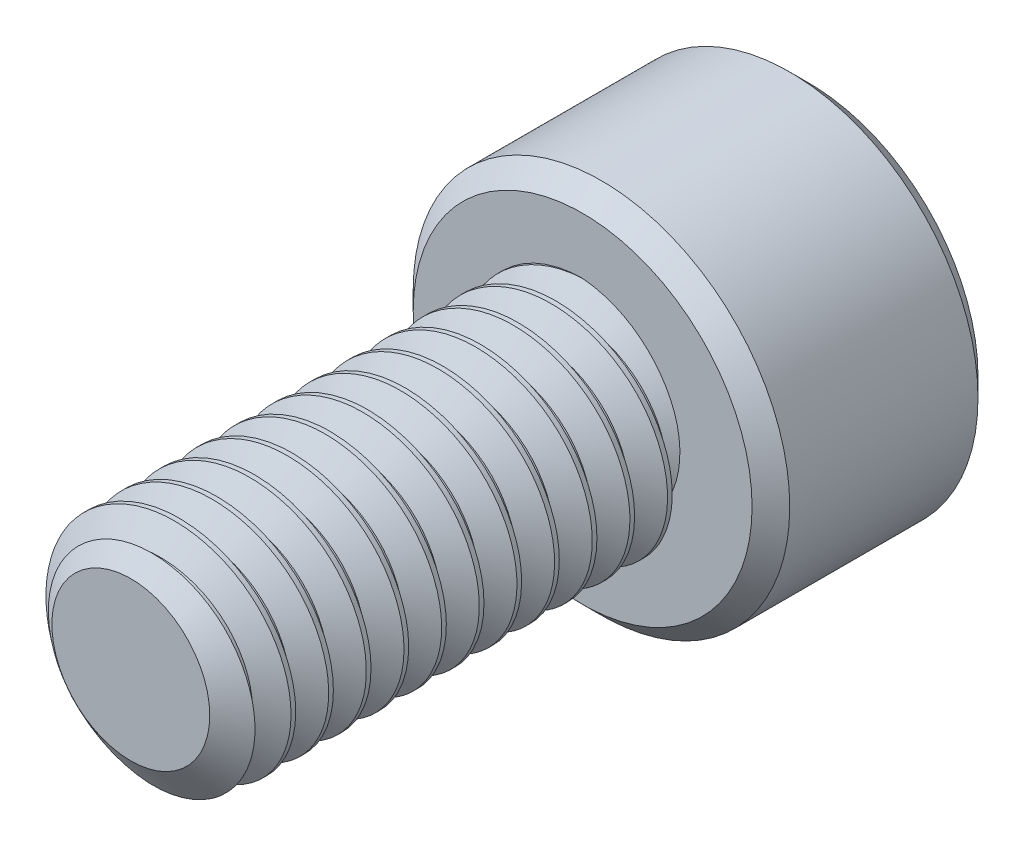
from build123d import *

# Parameters (mm, degrees)
SKETCH1_R          = 3
EXTRUDE1_DEPTH     = 12
CUT_SWEEP1_PITCH   = 1
SKETCH6_R          = 5
EXTRUDE2_DEPTH     = 6
CUT_EXTRUDE1_DEPTH = 3.75
CHAMFER1_SIZE      = 0.5


with BuildPart() as part:
    # Sketch1 → Extrude1 (new body)
    with BuildSketch(Plane.XY):
        Circle(SKETCH1_R)
    extrude(amount=-EXTRUDE1_DEPTH)

    # Cut-Sweep1: the profile of Sketch3 profile screwed along a right-hand helix of 13 turns, 6 arcs to a turn; built about Z, then put on its axis
    cut_sweep1_z = Axis((0, 0, 0), (0, 0, 1))
    cut_sweep1_corners = [(3.0003, 0, -0.875173205), (2.350480947, 0, -0.5), (2.350480947, 0, -0.375), (3.0003, 0, 0.000173205)]
    with BuildLine(mode=Mode.PRIVATE) as cut_sweep1_profile:
        Line(cut_sweep1_corners[0], cut_sweep1_corners[1])
        Line(cut_sweep1_corners[1], cut_sweep1_corners[2])
        Line(cut_sweep1_corners[2], cut_sweep1_corners[3])
        Line(cut_sweep1_corners[3], cut_sweep1_corners[0])
    cut_sweep1_cap = Face(cut_sweep1_profile.wire())
    cut_sweep1_turn_angles = [0, 30, 60, 90, 120, 150, 180, 210, 240, 270, 300, 330, 360]
    cut_sweep1_turn_weights = [1, 0.8660254037844387, 1, 0.8660254037844387, 1, 0.8660254037844387, 1, 0.8660254037844387, 1, 0.8660254037844387, 1, 0.8660254037844387, 1]
    cut_sweep1_turn_rails = [Edge.make_bspline([Vector(p[0], p[1], 0).rotate(cut_sweep1_z, cut_sweep1_turn_angles[k]) / cut_sweep1_turn_weights[k] + Vector(0, 0, p[2] + CUT_SWEEP1_PITCH * cut_sweep1_turn_angles[k] / 360) for k in range(13)], [0, 0, 0, 1, 1, 2, 2, 3, 3, 4, 4, 5, 5, 6, 6, 6], 2, cut_sweep1_turn_weights) for p in cut_sweep1_corners]
    cut_sweep1_turn_sides = [Face.make_surface_from_curves(cut_sweep1_turn_rails[p[0]], cut_sweep1_turn_rails[p[1]]) for p in [(0, 1), (1, 2), (2, 3), (3, 0)]]
    cut_sweep1 = Plane(origin=(0, 0, 0), x_dir=(0, 1, 0), z_dir=(0, 0, -1)) * Solid(Shell([*[p.moved(Location((0, 0, CUT_SWEEP1_PITCH * i))) for i in range(13) for p in cut_sweep1_turn_sides], cut_sweep1_cap, cut_sweep1_cap.rotate(cut_sweep1_z, 4680).moved(Location((0, 0, CUT_SWEEP1_PITCH * 4680 / 360)))]))
    add(cut_sweep1, mode=Mode.SUBTRACT)

    # Sketch4 → Cut-Revolve1 (revolve, cut)
    with BuildSketch(Plane(origin=(0, 0, 0), x_dir=(0, 0, -1), z_dir=(1, 0, 0)), mode=Mode.PRIVATE) as cut_revolve1_sk:
        Polygon((0.632650852, 3), (0, 2.096480947), (0, 3), align=None)
    revolve(cut_revolve1_sk.sketch.rotate(Axis((0, 0, 0), (0, 0, -1)), 244.349292568), axis=Axis((0, 0, 0), (0, 0, -1)), mode=Mode.SUBTRACT)

    # Sketch6 → Extrude2 (add)
    with BuildSketch(Plane(origin=(0, 0, -12), x_dir=(-1, 0, 0), z_dir=(0, 0, -1))):
        Circle(SKETCH6_R)
    extrude(amount=EXTRUDE2_DEPTH)

    # Sketch7 → Cut-Extrude1 (cut)
    with BuildSketch(Plane(origin=(0, 0, -18), x_dir=(-1, 0, 0), z_dir=(0, 0, -1))):
        Polygon((0, 2.886751346), (-2.5, 1.443375673), (-2.5, -1.443375673), (0, -2.886751346), (2.5, -1.443375673), (2.5, 1.443375673), align=None)
    extrude(amount=-CUT_EXTRUDE1_DEPTH, mode=Mode.SUBTRACT)

    # Cut-Extrude2 cone 1 section (through the dimple's axis) → Cut-Extrude2 (revolve, cut)
    with BuildSketch(Plane(origin=(0, 0, -18), x_dir=(0, 1, 0), z_dir=(1, 0, 0))):
        Polygon((0, 0), (2.886751346, 0), (0, 2.886751346), align=None)
    revolve(axis=Axis((0, 0, -18), (0, 0, 1)), mode=Mode.SUBTRACT)

    # Chamfer1
    chamfer1_edges = [part.edges().sort_by_distance(p)[0] for p in [
        (5, 0, -12),
        (5, 0, -18),
    ]]
    chamfer(chamfer1_edges, length=CHAMFER1_SIZE)


solid = part.part
